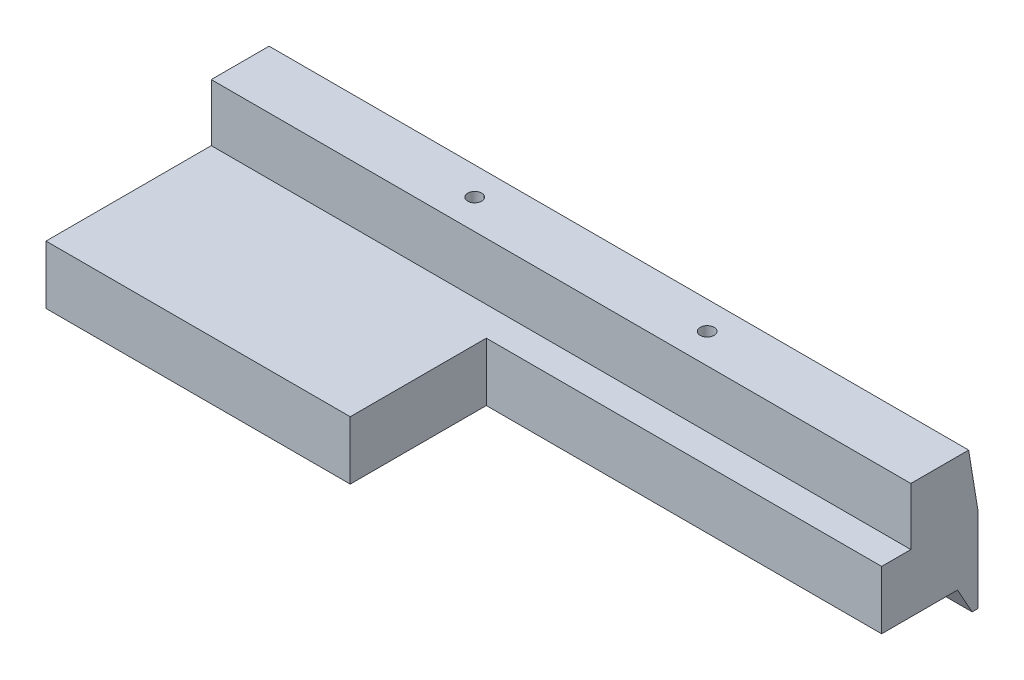
from build123d import *

# Parameters (mm, degrees)
SZKIC1_W                                             = 119.8
SZKIC1_H                                             = 10
DODANIE_WYCI_GNI_CIE2_DEPTH                          = 38.3
SZKIC21_W                                            = 119.8
SZKIC21_H                                            = 10
DODANIE_WYCI_GNI_CIE3_DEPTH                          = 9.8
POG_BIENIE_WALCOWE_POD_M2_WKR_T_DO_CZ_CI_D           = 2.4
POG_BIENIE_WALCOWE_POD_M2_WKR_T_DO_CZ_CI_CBORE_D     = 5
POG_BIENIE_WALCOWE_POD_M2_WKR_T_DO_CZ_CI_CBORE_DEPTH = 1.6
SZKIC28_R                                            = 11.1
WYTNIJ_WYCI_GNI_CIE1_DEPTH                           = 7.2
WYTNIJ_WYCI_GNI_CIE4_DEPTH                           = 124.8
DODANIE_WYCI_GNI_CIE5_DEPTH                          = 119.8
SZKIC34_W                                            = 119.8
SZKIC34_H                                            = 10
DODANIE_WYCI_GNI_CIE6_DEPTH                          = 1.5
SZKIC53_W                                            = 67.7
SZKIC53_H                                            = 10
WYTNIJ_WYCI_GNI_CIE5_DEPTH                           = 23.3
DODANIE_WYCI_GNI_CIE12_DEPTH                         = 119.8
SZKIC55_R                                            = 5.1
WYTNIJ_WYCI_GNI_CIE6_DEPTH                           = 4.1


with BuildPart() as part:
    # Szkic1 → Dodanie-wyciągnięcie2 (new body)
    with BuildSketch(Plane.XY):
        with Locations((1.59336777, 27.024849398)):
            Rectangle(SZKIC1_W, SZKIC1_H)
    extrude(amount=DODANIE_WYCI_GNI_CIE2_DEPTH)

    # Szkic21 → Dodanie-wyciągnięcie3 (add)
    with BuildSketch(Plane(origin=(0, 32.024849398, 0), x_dir=(1, 0, 0), z_dir=(0, 1, 0))):
        with Locations((1.59336777, -5)):
            Rectangle(SZKIC21_W, SZKIC21_H)
    extrude(amount=DODANIE_WYCI_GNI_CIE3_DEPTH)

    # Pogłębienie walcowe pod M2 wkręt do części metalowych z łbem stożkowym ściętym2 (through all)
    with Locations(Plane(origin=(0, 22.024849398, 0), x_dir=(-1, 0, 0), z_dir=(0, -1, 0))):
        with Locations((-21.49336777, -4.88), (18.30663223, -4.88)):
            CounterBoreHole(POG_BIENIE_WALCOWE_POD_M2_WKR_T_DO_CZ_CI_D / 2, POG_BIENIE_WALCOWE_POD_M2_WKR_T_DO_CZ_CI_CBORE_D / 2, POG_BIENIE_WALCOWE_POD_M2_WKR_T_DO_CZ_CI_CBORE_DEPTH)

    # Szkic28 → Wytnij-wyciągnięcie1 (cut)
    with BuildSketch(Plane.XZ.offset(-22.024849398)):
        with Locations((36.49336777, 23.3)):
            Circle(SZKIC28_R)
    extrude(amount=-WYTNIJ_WYCI_GNI_CIE1_DEPTH, mode=Mode.SUBTRACT)

    # Szkic31 → Wytnij-wyciągnięcie4 (cut)
    with BuildSketch(Plane(origin=(61.49336777, 0, 0), x_dir=(0, 0, -1), z_dir=(1, 0, 0))):
        Polygon((0, 41.824849398), (-0.096491228, 41.824849398), (0, 41.232541705), align=None)
    extrude(amount=-WYTNIJ_WYCI_GNI_CIE4_DEPTH, mode=Mode.SUBTRACT)

    # Szkic31<5> → Dodanie-wyciągnięcie5 (add)
    with BuildSketch(Plane(origin=(61.49336777, 0, 0), x_dir=(0, 0, -1), z_dir=(1, 0, 0))):
        Polygon((0, 41.232541705), (0, 32.024849398), (1.5, 32.024849398), (0.275236278, 39.543014399), align=None)
    extrude(amount=-DODANIE_WYCI_GNI_CIE5_DEPTH)

    # Szkic34 → Dodanie-wyciągnięcie6 (add)
    with BuildSketch(Plane(origin=(0, 0, 0), x_dir=(-1, 0, 0), z_dir=(0, 0, -1))):
        with Locations((-1.59336777, 27.024849398)):
            Rectangle(SZKIC34_W, SZKIC34_H)
    extrude(amount=DODANIE_WYCI_GNI_CIE6_DEPTH)

    # Szkic53 → Wytnij-wyciągnięcie5 (cut)
    with BuildSketch(Plane.XY.offset(38.3)):
        with Locations((-24.45663223, 27.024849398)):
            Rectangle(SZKIC53_W, SZKIC53_H)
    extrude(amount=-WYTNIJ_WYCI_GNI_CIE5_DEPTH, mode=Mode.SUBTRACT)

    # Szkic54 → Dodanie-wyciągnięcie12 (add)
    with BuildSketch(Plane(origin=(61.49336777, 0, 0), x_dir=(0, 0, -1), z_dir=(1, 0, 0))):
        Polygon((-2, 22.024849398), (1.5, 22.024849398), (1.5, 17.524849398), (0.5, 17.524849398), align=None)
    extrude(amount=-DODANIE_WYCI_GNI_CIE12_DEPTH)


with BuildPart() as body_2:
    # Lustro1: mirrored copy
    add(part.part.mirror(Plane(origin=(-58.30663223, 32.024849398, 38.3), x_dir=(0, 0, 1), z_dir=(1, 0, 0))))

    # Szkic55 → Wytnij-wyciągnięcie6 (cut)
    with BuildSketch(Plane.XZ.offset(-22.024849398)):
        with Locations((-108.30663223, 8.5)):
            Circle(SZKIC55_R)
        with Locations((-70.80663223, 8.5)):
            Circle(SZKIC55_R)
    extrude(amount=-WYTNIJ_WYCI_GNI_CIE6_DEPTH, mode=Mode.SUBTRACT)


solid = body_2.part
